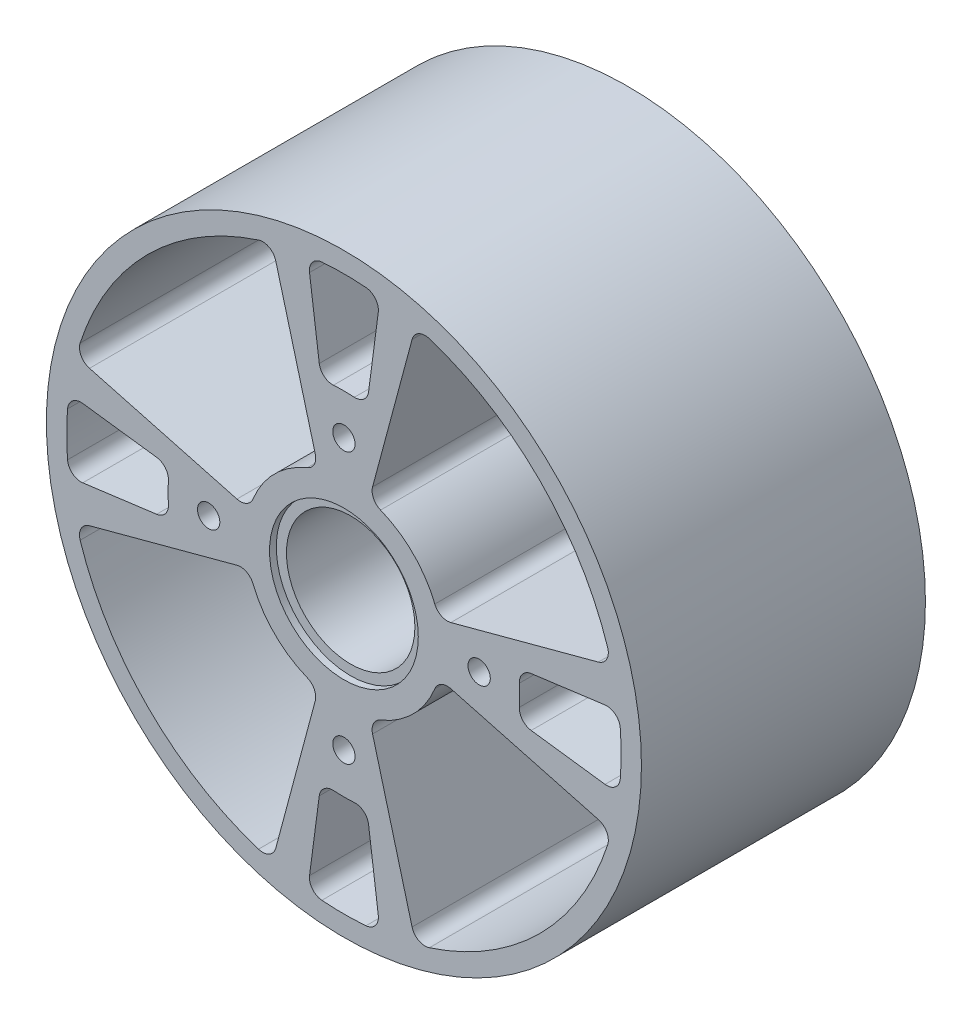
from build123d import *

# Parameters (mm, degrees)
SKETCH_1_R              = 44
SKETCH_1_R_2            = 41
EXTRUDE_1_DEPTH         = 6
SKETCH_2_R              = 44
EXTRUDE_2_DEPTH         = 36
SKETCH_3_R              = 44
SKETCH_3_R_2            = 39
EXTRUDE_3_DEPTH         = 10
CUT_EXTRUDE_START       = -36
CUT_EXTRUDE_1_OUTLINE_R = 9.5
CUT_EXTRUDE_1_DEPTH     = 36
FILLET_1_R              = 2
CUT_EXTRUDE_5_REACH     = 77.073
SKETCH_8_R              = 1.65
CUT_EXTRUDE_START_2     = -10
SKETCH_9_R              = 44
CUT_EXTRUDE_6_DEPTH     = 10
CUT_EXTRUDE_7_REACH     = 77.073
SKETCH_13_R             = 11
CUT_EXTRUDE_8_DEPTH     = 1
FILLET_2_R              = 2


# Read off the part's stored shape, not the designer's step: 切除-拉伸1
with BuildPart() as part:
    # 草图1 → 凸台-拉伸1 (new body)
    with BuildSketch(Plane.XY):
        Circle(SKETCH_1_R)
        Circle(SKETCH_1_R_2, mode=Mode.SUBTRACT)
    extrude(amount=EXTRUDE_1_DEPTH)

    # 草图2 → 凸台-拉伸2 (add)
    with BuildSketch(Plane.XY.offset(6)):
        Circle(SKETCH_2_R)
    extrude(amount=EXTRUDE_2_DEPTH)

    # 草图3 → 凸台-拉伸3 (add)
    with BuildSketch(Plane.XY.offset(42)):
        Circle(SKETCH_3_R)
        Circle(SKETCH_3_R_2, mode=Mode.SUBTRACT)
    extrude(amount=EXTRUDE_3_DEPTH)

    # 切除-拉伸1 outline → 切除-拉伸1 (cut)
    with BuildSketch(Plane.XY.offset(42).offset(CUT_EXTRUDE_START)):
        with BuildLine():
            Line((14.005924481, 3.752876154), (39.602958878, 10.611580849))
            ThreePointArc((39.602958878, 10.611580849), (28.991378029, 28.991378029), (10.611580849, 39.602958878))
            Line((10.611580849, 39.602958878), (3.752876154, 14.005924481))
            ThreePointArc((3.752876154, 14.005924481), (10.253048327, 10.253048327), (14.005924481, 3.752876154))
        make_face()
        with BuildLine():
            ThreePointArc((10.611580849, -39.602958878), (28.991378029, -28.991378029), (39.602958878, -10.611580849))
            Line((39.602958878, -10.611580849), (14.005924481, -3.752876154))
            ThreePointArc((14.005924481, -3.752876154), (10.253048327, -10.253048327), (3.752876154, -14.005924481))
            Line((3.752876154, -14.005924481), (10.611580849, -39.602958878))
        make_face()
        with BuildLine():
            Line((-3.752876154, 14.005924481), (-10.611580849, 39.602958878))
            ThreePointArc((-10.611580849, 39.602958878), (-28.991378029, 28.991378029), (-39.602958878, 10.611580849))
            Line((-39.602958878, 10.611580849), (-14.005924481, 3.752876154))
            ThreePointArc((-14.005924481, 3.752876154), (-10.253048327, 10.253048327), (-3.752876154, 14.005924481))
        make_face()
        with BuildLine():
            ThreePointArc((-39.602958878, -10.611580849), (-28.991378029, -28.991378029), (-10.611580849, -39.602958878))
            Line((-10.611580849, -39.602958878), (-3.752876154, -14.005924481))
            ThreePointArc((-3.752876154, -14.005924481), (-10.253048327, -10.253048327), (-14.005924481, -3.752876154))
            Line((-14.005924481, -3.752876154), (-39.602958878, -10.611580849))
        make_face()
        Circle(CUT_EXTRUDE_1_OUTLINE_R)
    extrude(amount=CUT_EXTRUDE_1_DEPTH, mode=Mode.SUBTRACT)

    # 圆角1
    # the kernel refuses this fillet: 2 mm, written as the material it adds along each edge
    with BuildSketch(Plane(origin=(-10.611580849, -39.602958878, 6), x_dir=(-0.9589694652555938, 0.2835093732267071, 0), z_dir=(0, 0, 1)), Plane(origin=(39.602958878, -10.611580849, 6), x_dir=(-0.2835093732267071, -0.9589694652555938, 0), z_dir=(0, 0, 1)), Plane(origin=(-39.602958878, 10.611580849, 6), x_dir=(0.2835093732267071, 0.9589694652555938, 0), z_dir=(0, 0, 1)), Plane(origin=(10.611580849, 39.602958878, 6), x_dir=(0.9589694652555938, -0.2835093732267071, 0), z_dir=(0, 0, 1))) as fillet_1_piece_1:
        with BuildLine():
            CenterArc((2.051957148, -1.999341997), FILLET_1_R, 88.530232757, 92.939534485)
            Line((0.052615152, -2.050640925), (0, 0))
            ThreePointArc((0, 0), (1.051628039, 0.013489067), (2.103256077, 0))
        make_face()
    extrude(amount=36)
    with BuildSketch(Plane(origin=(-39.602958878, -10.611580849, 6), x_dir=(0.2835093732267017, -0.9589694652555955, 0), z_dir=(0, 0, 1)), Plane(origin=(10.611580849, -39.602958878, 6), x_dir=(0.9589694652555955, 0.2835093732267017, 0), z_dir=(0, 0, 1)), Plane(origin=(-10.611580849, 39.602958878, 6), x_dir=(-0.9589694652555955, -0.2835093732267017, 0), z_dir=(0, 0, 1)), Plane(origin=(39.602958878, 10.611580849, 6), x_dir=(-0.2835093732267017, 0.9589694652555955, 0), z_dir=(0, 0, 1))) as fillet_1_piece_2:
        with BuildLine():
            CenterArc((2.051957148, 1.999341997), FILLET_1_R, 178.530232759, 92.939534485)
            Line((0.052615152, 2.050640925), (0, 0))
            ThreePointArc((0, 0), (1.051628039, -0.013489067), (2.103256077, 0))
        make_face()
    extrude(amount=36)
    with BuildSketch(Plane(origin=(-14.005924481, -3.752876154, 6), x_dir=(0.316990681826872, -0.9484286518420534, 0), z_dir=(0, 0, 1)), Plane(origin=(3.752876154, -14.005924481, 6), x_dir=(0.9484286518420534, 0.316990681826872, 0), z_dir=(0, 0, 1)), Plane(origin=(-3.752876154, 14.005924481, 6), x_dir=(-0.9484286518420534, -0.316990681826872, 0), z_dir=(0, 0, 1)), Plane(origin=(14.005924481, 3.752876154, 6), x_dir=(-0.316990681826872, 0.9484286518420534, 0), z_dir=(0, 0, 1))) as fillet_1_piece_3:
        with BuildLine():
            CenterArc((1.882260735, -1.99630991), FILLET_1_R, 93.481031345, 83.037937307)
            Line((-0.114049175, -1.874873733), (0, 0))
            ThreePointArc((0, 0), (0.880412279, -0.026753156), (1.760824558, 0))
        make_face()
    extrude(amount=36)
    with BuildSketch(Plane(origin=(-3.752876154, -14.005924481, 6), x_dir=(-0.2588190450916834, -0.9659258262919722, 0), z_dir=(0, 0, 1)), Plane(origin=(14.005924481, -3.752876154, 6), x_dir=(0.9659258262919722, -0.2588190450916834, 0), z_dir=(0, 0, 1)), Plane(origin=(-14.005924481, 3.752876154, 6), x_dir=(-0.9659258262919722, 0.2588190450916834, 0), z_dir=(0, 0, 1)), Plane(origin=(3.752876154, 14.005924481, 6), x_dir=(0.2588190450916834, 0.9659258262919722, 0), z_dir=(0, 0, 1))) as fillet_1_piece_4:
        with BuildLine():
            CenterArc((1.878339354, -2), FILLET_1_R, 90, 83.037937307)
            ThreePointArc((-0.106913901, -1.757575758), (-0.026753156, -0.880412279), (0, 0))
            Line((0, 0), (1.878339354, 0))
        make_face()
    extrude(amount=36)

    # 草图8 → 切除-拉伸5 (cut, up to next)
    with BuildSketch(Plane.XY.offset(42), mode=Mode.PRIVATE) as cut_extrude_5_sk1:
        with Locations((0, 20)):
            Circle(SKETCH_8_R)
    cut_extrude_5_tool1 = extrude(cut_extrude_5_sk1.sketch, amount=-CUT_EXTRUDE_5_REACH, mode=Mode.PRIVATE) & part.part
    # 草图8 → 切除-拉伸5 (cut, up to next)
    with BuildSketch(Plane.XY.offset(42), mode=Mode.PRIVATE) as cut_extrude_5_sk2:
        with Locations((20, 0)):
            Circle(SKETCH_8_R)
    cut_extrude_5_tool2 = extrude(cut_extrude_5_sk2.sketch, amount=-CUT_EXTRUDE_5_REACH, mode=Mode.PRIVATE) & part.part
    # 草图8 → 切除-拉伸5 (cut, up to next)
    with BuildSketch(Plane.XY.offset(42), mode=Mode.PRIVATE) as cut_extrude_5_sk3:
        with Locations((0, -20)):
            Circle(SKETCH_8_R)
    cut_extrude_5_tool3 = extrude(cut_extrude_5_sk3.sketch, amount=-CUT_EXTRUDE_5_REACH, mode=Mode.PRIVATE) & part.part
    # 草图8 → 切除-拉伸5 (cut, up to next)
    with BuildSketch(Plane.XY.offset(42), mode=Mode.PRIVATE) as cut_extrude_5_sk4:
        with Locations((-20, 0)):
            Circle(SKETCH_8_R)
    cut_extrude_5_tool4 = extrude(cut_extrude_5_sk4.sketch, amount=-CUT_EXTRUDE_5_REACH, mode=Mode.PRIVATE) & part.part
    add(cut_extrude_5_tool1.solids().sort_by_distance((0, 20, 42))[0], mode=Mode.SUBTRACT)
    add(cut_extrude_5_tool2.solids().sort_by_distance((20, 0, 42))[0], mode=Mode.SUBTRACT)
    add(cut_extrude_5_tool3.solids().sort_by_distance((0, -20, 42))[0], mode=Mode.SUBTRACT)
    add(cut_extrude_5_tool4.solids().sort_by_distance((-20, 0, 42))[0], mode=Mode.SUBTRACT)

    # 草图9 → 切除-拉伸6 (cut)
    with BuildSketch(Plane.XY.offset(52).offset(CUT_EXTRUDE_START_2)):
        Circle(SKETCH_9_R)
    extrude(amount=CUT_EXTRUDE_6_DEPTH, mode=Mode.SUBTRACT)

    # 草图12 → 切除-拉伸7 (cut, up to next)
    with BuildSketch(Plane.XY.offset(42), mode=Mode.PRIVATE) as cut_extrude_7_sk1:
        with BuildLine():
            Line((-3.393680998, 25.777566396), (-5.351573881, 40.649239316))
            ThreePointArc((-5.351573881, 40.649239316), (0, 41), (5.351573881, 40.649239316))
            Line((5.351573881, 40.649239316), (3.393680998, 25.777566396))
            ThreePointArc((3.393680998, 25.777566396), (0, 26), (-3.393680998, 25.777566396))
        make_face()
    cut_extrude_7_tool1 = extrude(cut_extrude_7_sk1.sketch, amount=-CUT_EXTRUDE_7_REACH, mode=Mode.PRIVATE) & part.part
    # 草图12 → 切除-拉伸7 (cut, up to next)
    with BuildSketch(Plane.XY.offset(42), mode=Mode.PRIVATE) as cut_extrude_7_sk2:
        with BuildLine():
            Line((25.777566396, 3.393680998), (40.649239316, 5.351573881))
            ThreePointArc((40.649239316, 5.351573881), (41, 0), (40.649239316, -5.351573881))
            Line((40.649239316, -5.351573881), (25.777566396, -3.393680998))
            ThreePointArc((25.777566396, -3.393680998), (26, 0), (25.777566396, 3.393680998))
        make_face()
    cut_extrude_7_tool2 = extrude(cut_extrude_7_sk2.sketch, amount=-CUT_EXTRUDE_7_REACH, mode=Mode.PRIVATE) & part.part
    # 草图12 → 切除-拉伸7 (cut, up to next)
    with BuildSketch(Plane.XY.offset(42), mode=Mode.PRIVATE) as cut_extrude_7_sk3:
        with BuildLine():
            Line((3.393680998, -25.777566396), (5.351573881, -40.649239316))
            ThreePointArc((5.351573881, -40.649239316), (0, -41), (-5.351573881, -40.649239316))
            Line((-5.351573881, -40.649239316), (-3.393680998, -25.777566396))
            ThreePointArc((-3.393680998, -25.777566396), (0, -26), (3.393680998, -25.777566396))
        make_face()
    cut_extrude_7_tool3 = extrude(cut_extrude_7_sk3.sketch, amount=-CUT_EXTRUDE_7_REACH, mode=Mode.PRIVATE) & part.part
    # 草图12 → 切除-拉伸7 (cut, up to next)
    with BuildSketch(Plane.XY.offset(42), mode=Mode.PRIVATE) as cut_extrude_7_sk4:
        with BuildLine():
            Line((-25.777566396, -3.393680998), (-40.649239316, -5.351573881))
            ThreePointArc((-40.649239316, -5.351573881), (-41, 0), (-40.649239316, 5.351573881))
            Line((-40.649239316, 5.351573881), (-25.777566396, 3.393680998))
            ThreePointArc((-25.777566396, 3.393680998), (-26, 0), (-25.777566396, -3.393680998))
        make_face()
    cut_extrude_7_tool4 = extrude(cut_extrude_7_sk4.sketch, amount=-CUT_EXTRUDE_7_REACH, mode=Mode.PRIVATE) & part.part
    add(cut_extrude_7_tool1.solids().sort_by_distance((0, 33.962517, 42))[0], mode=Mode.SUBTRACT)
    add(cut_extrude_7_tool2.solids().sort_by_distance((33.962517, 0, 42))[0], mode=Mode.SUBTRACT)
    add(cut_extrude_7_tool3.solids().sort_by_distance((0, -33.962517, 42))[0], mode=Mode.SUBTRACT)
    add(cut_extrude_7_tool4.solids().sort_by_distance((-33.962517, 0, 42))[0], mode=Mode.SUBTRACT)

    # 草图13 → 切除-拉伸8 (cut)
    with BuildSketch(Plane.XY.offset(42)):
        Circle(SKETCH_13_R)
    extrude(amount=-CUT_EXTRUDE_8_DEPTH, mode=Mode.SUBTRACT)

    # 圆角2
    # the kernel refuses this fillet: 2 mm, written as the material it adds along each edge
    with BuildSketch(Plane(origin=(-5.351573881, 40.649239316, 42), x_dir=(0.130526192220052, -0.9914448613738104, 0), z_dir=(0, 0, -1)), Plane(origin=(40.649239316, 5.351573881, 42), x_dir=(-0.9914448613738104, -0.13052619222005157, 0), z_dir=(0, 0, -1)), Plane(origin=(5.351573881, -40.649239316, 42), x_dir=(-0.13052619222005268, 0.9914448613738102, 0), z_dir=(0, 0, -1)), Plane(origin=(-40.649239316, -5.351573881, 42), x_dir=(0.9914448613738104, 0.13052619222005277, 0), z_dir=(0, 0, -1))) as fillet_2_piece_1:
        with BuildLine():
            CenterArc((2.051315812, -2), FILLET_2_R, 90, 92.939534486)
            ThreePointArc((0.053947392, -2.102564103), (0.013489067, -1.051628039), (0, 0))
            Line((0, 0), (2.051315812, 0))
        make_face()
    extrude(amount=36)
    with BuildSketch(Plane(origin=(5.351573881, 40.649239316, 42), x_dir=(-0.1305261922200523, -0.9914448613738103, 0), z_dir=(0, 0, -1)), Plane(origin=(40.649239316, -5.351573881, 42), x_dir=(-0.9914448613738103, 0.1305261922200523, 0), z_dir=(0, 0, -1)), Plane(origin=(-5.351573881, -40.649239316, 42), x_dir=(0.13052619222005238, 0.9914448613738104, 0), z_dir=(0, 0, -1)), Plane(origin=(-40.649239316, 5.351573881, 42), x_dir=(0.9914448613738103, -0.13052619222005185, 0), z_dir=(0, 0, -1))) as fillet_2_piece_2:
        with BuildLine():
            CenterArc((2.051315812, 2), FILLET_2_R, 177.060465514, 92.939534486)
            ThreePointArc((0.053947392, 2.102564103), (0.013489067, 1.051628039), (0, 0))
            Line((0, 0), (2.051315812, 0))
        make_face()
    extrude(amount=36)
    with BuildSketch(Plane(origin=(3.393680998, 25.777566396, 42), x_dir=(0.1305261922200518, 0.9914448613738104, 0), z_dir=(0, 0, -1)), Plane(origin=(25.777566396, -3.393680998, 42), x_dir=(0.9914448613738103, -0.130526192220052, 0), z_dir=(0, 0, -1)), Plane(origin=(-3.393680998, -25.777566396, 42), x_dir=(-0.13052619222005202, -0.9914448613738104, 0), z_dir=(0, 0, -1)), Plane(origin=(-25.777566396, 3.393680998, 42), x_dir=(-0.9914448613738104, 0.13052619222005157, 0), z_dir=(0, 0, -1))) as fillet_2_piece_3:
        with BuildLine():
            CenterArc((1.928480088, -2), FILLET_2_R, 90, 85.903956242)
            ThreePointArc((-0.066411347, -1.857142857), (-0.016608141, -0.929164956), (0, 0))
            Line((0, 0), (1.928480088, 0))
        make_face()
    extrude(amount=36)
    with BuildSketch(Plane(origin=(-3.393680998, 25.777566396, 42), x_dir=(0.9954761808852897, 0.09501143768009296, 0), z_dir=(0, 0, -1)), Plane(origin=(25.777566396, 3.393680998, 42), x_dir=(0.09501143768008931, -0.99547618088529, 0), z_dir=(0, 0, -1)), Plane(origin=(3.393680998, -25.777566396, 42), x_dir=(-0.99547618088529, -0.09501143768008934, 0), z_dir=(0, 0, -1)), Plane(origin=(-25.777566396, -3.393680998, 42), x_dir=(-0.09501143768009106, 0.9954761808852899, 0), z_dir=(0, 0, -1))) as fillet_2_piece_4:
        with BuildLine():
            CenterArc((1.929804139, -1.998722451), FILLET_2_R, 92.048021879, 85.903956242)
            Line((-0.068918312, -1.927248223), (0, 0))
            ThreePointArc((0, 0), (0.929164956, -0.016608141), (1.858329911, 0))
        make_face()
    extrude(amount=36)


solid = part.part
